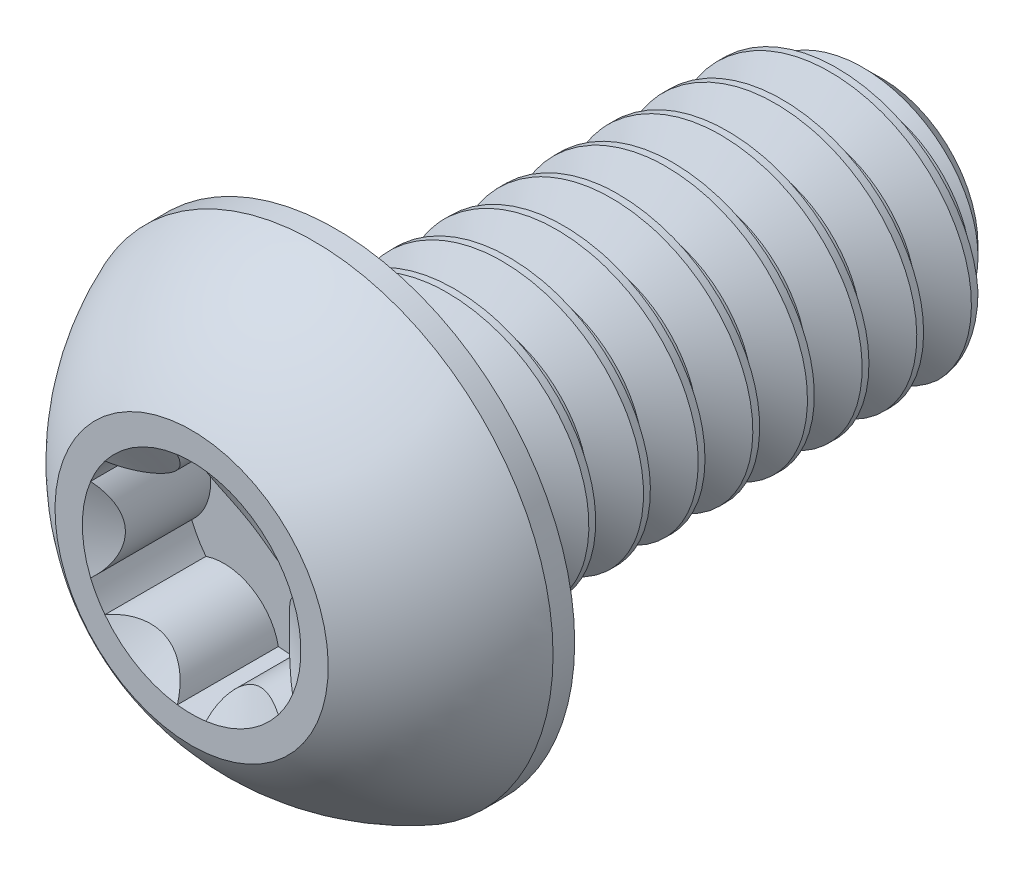
from build123d import *

# Parameters (mm, degrees)
SKETCH1_W          = 12.7
SKETCH1_H          = 3.175
CHAMFER1_SIZE      = 0.9525
CUT_SWEEP1_PITCH   = 1.27
CUT_EXTRUDE2_DEPTH = 2.34696
CIRPATTERN1_COUNT  = 6


with BuildPart() as part:
    # Sketch1 → Revolve1 (revolve)
    with BuildSketch(Plane(origin=(0, 0, 0), x_dir=(0, 0, -1), z_dir=(1, 0, 0))):
        with Locations((9.7028, 1.5875)):
            Rectangle(SKETCH1_W, SKETCH1_H)
    revolve(axis=Axis((0, 0, -16.0528), (0, 0, 1)))

    # Chamfer1
    chamfer1_edges = [part.edges().sort_by_distance(p)[0] for p in [
        (0, -3.175, -16.0528),
    ]]
    chamfer(chamfer1_edges, length=CHAMFER1_SIZE)

    # Cut-Sweep1: the profile of Sketch2 profile screwed along a right-hand helix of 11 turns, 8 arcs to a turn; built about Z, then put on its axis
    cut_sweep1_z = Axis((0, 0, 0), (0, 0, 1))
    cut_sweep1_corners = [(3.1753, 0, 0.000173205), (3.1753, 0, -1.111423205), (2.350110803, 0, -0.635), (2.350110803, 0, -0.47625)]
    with BuildLine(mode=Mode.PRIVATE) as cut_sweep1_profile:
        Line(cut_sweep1_corners[0], cut_sweep1_corners[1])
        Line(cut_sweep1_corners[1], cut_sweep1_corners[2])
        Line(cut_sweep1_corners[2], cut_sweep1_corners[3])
        Line(cut_sweep1_corners[3], cut_sweep1_corners[0])
    cut_sweep1_cap = Face(cut_sweep1_profile.wire())
    cut_sweep1_turn_angles = [0, 22.5, 45, 67.5, 90, 112.5, 135, 157.5, 180, 202.5, 225, 247.5, 270, 292.5, 315, 337.5, 360]
    cut_sweep1_turn_weights = [1, 0.9238795325112867, 1, 0.9238795325112867, 1, 0.9238795325112867, 1, 0.9238795325112867, 1, 0.9238795325112867, 1, 0.9238795325112867, 1, 0.9238795325112867, 1, 0.9238795325112867, 1]
    cut_sweep1_turn_rails = [Edge.make_bspline([Vector(p[0], p[1], 0).rotate(cut_sweep1_z, cut_sweep1_turn_angles[k]) / cut_sweep1_turn_weights[k] + Vector(0, 0, p[2] + CUT_SWEEP1_PITCH * cut_sweep1_turn_angles[k] / 360) for k in range(17)], [0, 0, 0, 1, 1, 2, 2, 3, 3, 4, 4, 5, 5, 6, 6, 7, 7, 8, 8, 8], 2, cut_sweep1_turn_weights) for p in cut_sweep1_corners]
    cut_sweep1_turn_sides = [Face.make_surface_from_curves(cut_sweep1_turn_rails[p[0]], cut_sweep1_turn_rails[p[1]]) for p in [(0, 1), (1, 2), (2, 3), (3, 0)]]
    cut_sweep1 = Plane(origin=(0, 0, -16.0528), x_dir=(0, 1, 0), z_dir=(0, 0, 1)) * Solid(Shell([*[p.moved(Location((0, 0, CUT_SWEEP1_PITCH * i))) for i in range(11) for p in cut_sweep1_turn_sides], cut_sweep1_cap, cut_sweep1_cap.rotate(cut_sweep1_z, 3960).moved(Location((0, 0, CUT_SWEEP1_PITCH * 3960 / 360)))]))
    add(cut_sweep1, mode=Mode.SUBTRACT)

    # Sketch7 → Revolve2 (revolve)
    with BuildSketch(Plane(origin=(0, 0, 0), x_dir=(0, 0, -1), z_dir=(1, 0, 0)), mode=Mode.PRIVATE) as revolve2_sk:
        with BuildLine():
            Line((2.84988, 5.5499), (3.3528, 5.5499))
            Line((3.3528, 5.5499), (3.3528, 0))
            Line((3.3528, 0), (0, 0))
            Line((0, 0), (0, 3.175))
            ThreePointArc((0, 3.175), (1.235921075, 4.58927271), (2.84988, 5.5499))
        make_face()
    revolve(revolve2_sk.sketch.rotate(Axis((0, 0, 0), (0, 0, -1)), 189.052465709), axis=Axis((0, 0, 0), (0, 0, -1)))

    # Sketch5 → Cut-Extrude2 (cut)
    with BuildSketch(Plane.XY):
        with BuildLine():
            Line((-2.199704526, -1.27), (0, 0))
            Line((0, 0), (-2.199704526, 1.27))
            ThreePointArc((-2.199704526, 1.27), (-2.278056763, 1.123413273), (-2.346654013, 0.972015918))
            ThreePointArc((-2.346654013, 0.972015918), (-1.905, 0), (-2.346654013, -0.972015918))
            ThreePointArc((-2.346654013, -0.972015918), (-2.278056763, -1.123413273), (-2.199704526, -1.27))
        make_face()
    cut_extrude2 = extrude(amount=-CUT_EXTRUDE2_DEPTH, mode=Mode.SUBTRACT)

    # CirPattern1: Cut-Extrude2 ×6 about axis
    cirpattern1_axis = Axis((0, 0, 0), (0, 0, 1))
    for i in range(1, CIRPATTERN1_COUNT):
        add(cut_extrude2.rotate(cirpattern1_axis, i * 360 / CIRPATTERN1_COUNT), mode=Mode.SUBTRACT)

    # Cut-Extrude3 cone 1 section (through the dimple's axis) → Cut-Extrude3 (revolve, cut)
    with BuildSketch(Plane(origin=(0, 0, 0), x_dir=(0, -1, 0), z_dir=(1, 0, 0))):
        Polygon((0, 0), (2.54, 0), (0, 1.466469684), align=None)
    revolve(axis=Axis((0, 0, 0), (0, 0, -1)), mode=Mode.SUBTRACT)


solid = part.part
